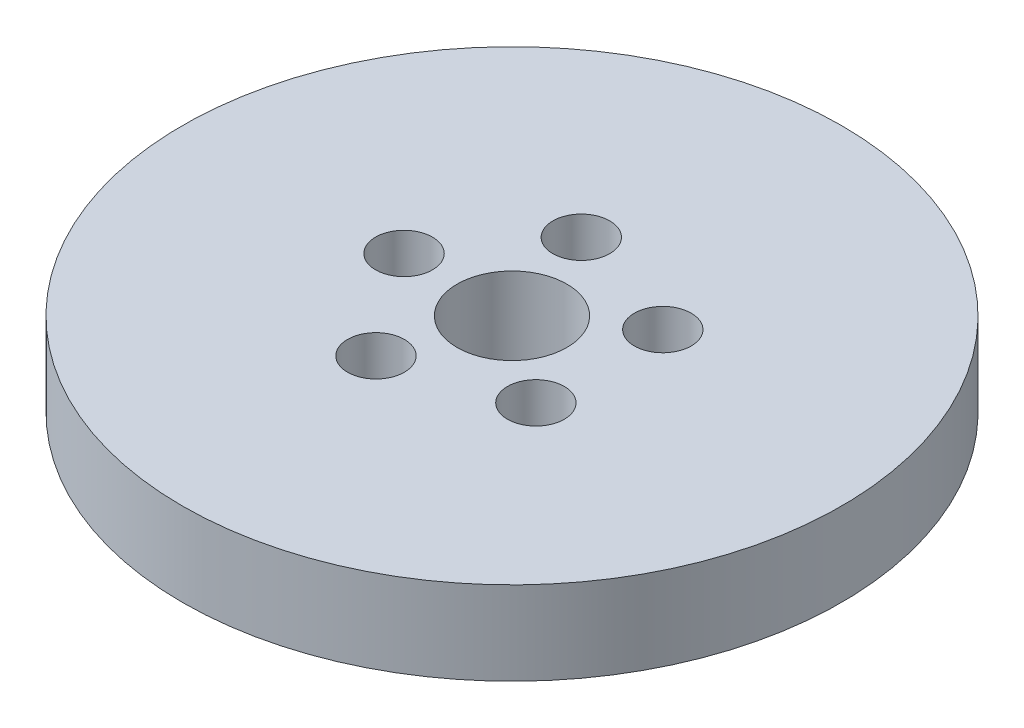
from build123d import *

# Parameters (mm, degrees)
SKETCH1_R           = 75
BOSS_EXTRUDE1_DEPTH = 19
SKETCH2_R           = 12.5
CUT_EXTRUDE1_DEPTH  = 108.75435026
SKETCH3_R           = 6.472488018
CUT_EXTRUDE2_DEPTH  = 18.29451223
CIRPATTERN1_COUNT   = 5


with BuildPart() as part:
    # Sketch1 → Boss-Extrude1 (new body)
    with BuildSketch(Plane(origin=(0, 0, 0), x_dir=(1, 0, 0), z_dir=(0, 1, 0))):
        Circle(SKETCH1_R)
    extrude(amount=BOSS_EXTRUDE1_DEPTH)

    # Sketch2 → Cut-Extrude1 (cut, through all)
    with BuildSketch(Plane(origin=(0, 0, 0), x_dir=(1, 0, 0), z_dir=(0, 1, 0))):
        Circle(SKETCH2_R)
    extrude(amount=CUT_EXTRUDE1_DEPTH, mode=Mode.SUBTRACT)

    # Sketch3 → Cut-Extrude2 (cut)
    with BuildSketch(Plane(origin=(0, 19, 0), x_dir=(1, 0, 0), z_dir=(0, 1, 0))):
        with Locations((-24.568982349, 0)):
            Circle(SKETCH3_R)
    cut_extrude2 = extrude(amount=-CUT_EXTRUDE2_DEPTH, mode=Mode.SUBTRACT)

    # CirPattern1: Cut-Extrude2 ×5 about axis
    cirpattern1_axis = Axis((0, 0, 0), (0, 1, 0))
    for i in range(1, CIRPATTERN1_COUNT):
        add(cut_extrude2.rotate(cirpattern1_axis, i * 360 / CIRPATTERN1_COUNT), mode=Mode.SUBTRACT)


solid = part.part
